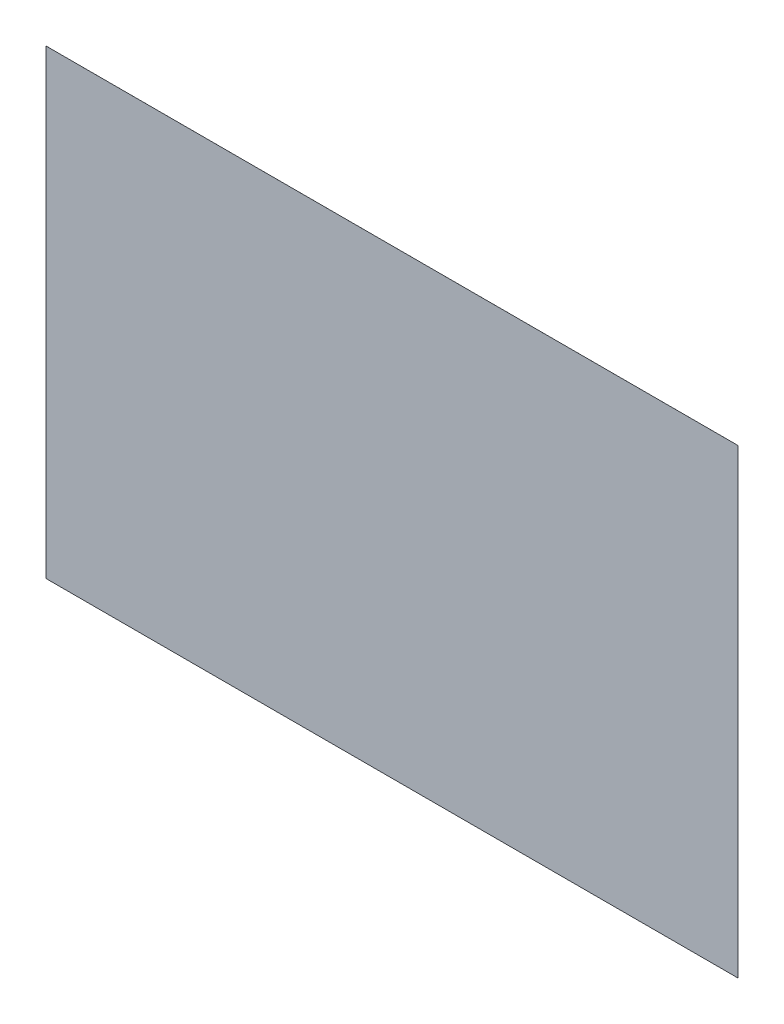
from build123d import *

# Parameters (mm, degrees)
SKETCH_1_W             = 60000
SKETCH_1_H             = 40000
SM_BASE_FLANGE_1_DEPTH = 1


# Sheet-metal steps are written as plain solids
with BuildPart() as part:
    # Sketch 1 → 基体-法兰1 (new body)
    with BuildSketch(Plane.XY):
        with Locations((30000, 20000)):
            Rectangle(SKETCH_1_W, SKETCH_1_H)
    extrude(amount=-SM_BASE_FLANGE_1_DEPTH)


solid = part.part
